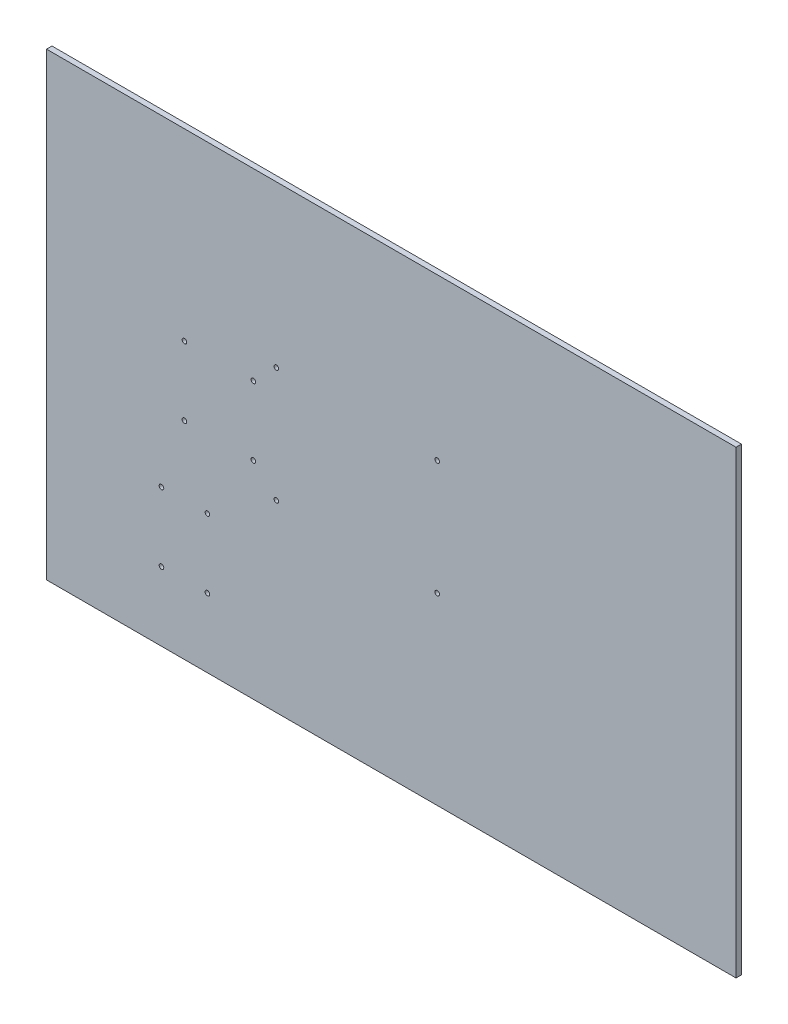
from build123d import *

# Parameters (mm, degrees)
SKETCH2_W           = 762
SKETCH2_H           = 508
SKETCH2_R           = 2.555
BOSS_EXTRUDE1_DEPTH = 6


with BuildPart() as part:
    # Sketch2 → Boss-Extrude1 (new body)
    with BuildSketch(Plane.XY):
        Rectangle(SKETCH2_W, SKETCH2_H)
        with Locations((-228.6, 50.8)):
            Circle(SKETCH2_R, mode=Mode.SUBTRACT)
        with Locations((-228.6, -25.4)):
            Circle(SKETCH2_R, mode=Mode.SUBTRACT)
        with Locations((-152.4, 50.8)):
            Circle(SKETCH2_R, mode=Mode.SUBTRACT)
        with Locations((-152.4, -25.4)):
            Circle(SKETCH2_R, mode=Mode.SUBTRACT)
        with Locations((-127, 76.2)):
            Circle(SKETCH2_R, mode=Mode.SUBTRACT)
        with Locations((-127, -50.8)):
            Circle(SKETCH2_R, mode=Mode.SUBTRACT)
        with Locations((50.8, 76.2)):
            Circle(SKETCH2_R, mode=Mode.SUBTRACT)
        with Locations((50.8, -50.8)):
            Circle(SKETCH2_R, mode=Mode.SUBTRACT)
        with Locations((-254, -177.8)):
            Circle(SKETCH2_R, mode=Mode.SUBTRACT)
        with Locations((-203.2, -177.8)):
            Circle(SKETCH2_R, mode=Mode.SUBTRACT)
        with Locations((-254, -101.6)):
            Circle(SKETCH2_R, mode=Mode.SUBTRACT)
        with Locations((-203.2, -101.6)):
            Circle(SKETCH2_R, mode=Mode.SUBTRACT)
    extrude(amount=BOSS_EXTRUDE1_DEPTH)


solid = part.part
